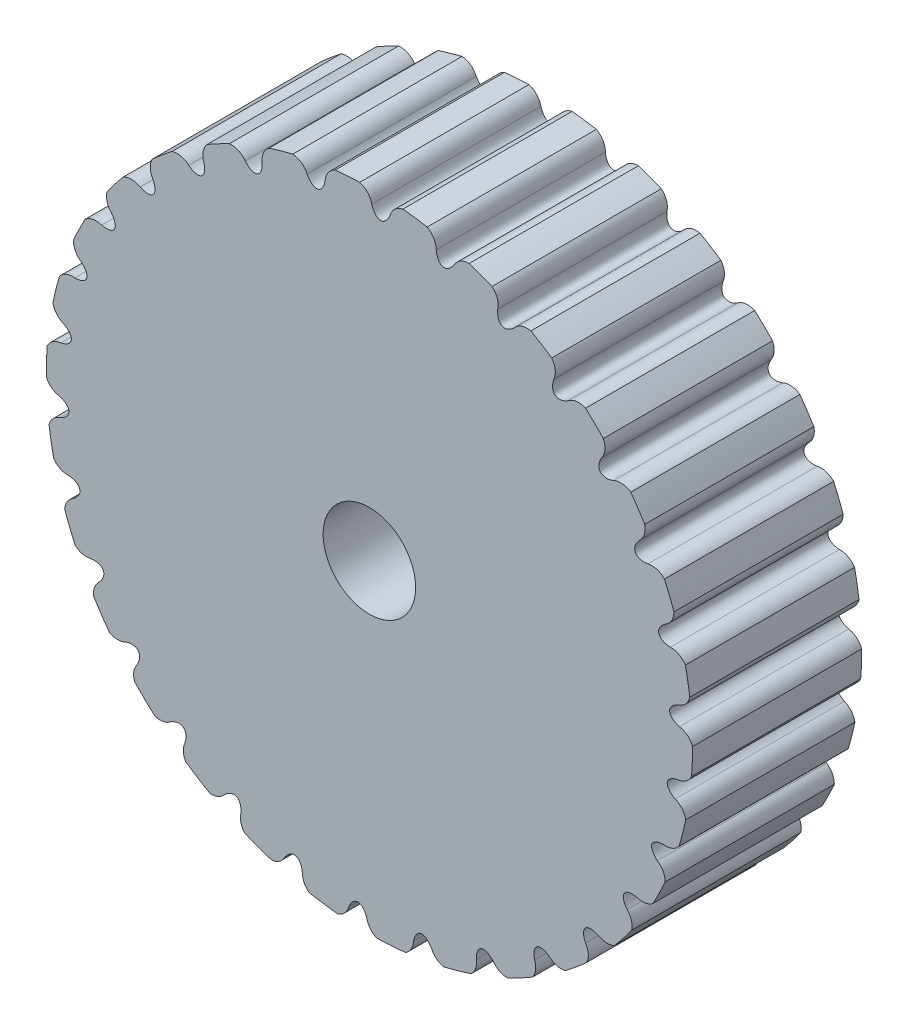
from build123d import *

# Parameters (mm, degrees)
SKETCH_1_R               = 28.647889755
EXTRUDE_1_DEPTH          = 15
CUT_EXTRUDE_3_DEPTH      = 15
PATTERN_CIRCULAR_1_DEPTH = 15
SKETCH_3_R               = 4.1
CUT_EXTRUDE_4_DEPTH      = 15


# Read off the part's stored shape, not the designer's step: Круговой массив1
with BuildPart() as part:
    # Эскиз1 → Бобышка-Вытянуть1 (new body)
    with BuildSketch(Plane.XY):
        Circle(SKETCH_1_R)
    extrude(amount=EXTRUDE_1_DEPTH)

    # Эскиз2 → Вырез-Вытянуть3 (cut)
    with BuildSketch(Plane.XY.offset(15)):
        with BuildLine():
            Line((4.783265488, 28.313897399), (4.555060767, 28.370295608))
            Line((4.555060767, 28.370295608), (7.420191225, 29.5242539))
            Line((7.420191225, 29.5242539), (9.194548177, 27.20324794))
            ThreePointArc((9.194548177, 27.20324794), (8.209649641, 27.119585332), (7.490641127, 26.441314505))
            add(Edge.make_bspline(
                [(5.923227103, 26.83594973), (6.165415766, 24.487827022), (7.490641127, 26.441314505)],
                knots=[5.342155302, 5.342155302, 5.342155302, 7.224215313, 7.224215313, 7.224215313], degree=2, weights=[1, 0.588955923, 1]))
            ThreePointArc((5.923227103, 26.83594973), (5.611124163, 27.773828354), (4.783265488, 28.313897399))
        make_face()
    extrude(amount=-CUT_EXTRUDE_3_DEPTH, mode=Mode.SUBTRACT)

    # Круговой массив1 outline → Круговой массив1 (cut)
    with BuildSketch(Plane.XY):
        with BuildLine():
            ThreePointArc((-0.857374536, 28.635057121), (-0.162957427, 28.208698815), (0.206087934, 27.482198954))
            add(Edge.make_bspline(
                [(0.206087934, 27.482198954), (0.931186357, 25.235742215), (1.821299478, 27.422071155)],
                knots=[5.342155302, 5.342155302, 5.342155302, 7.224215313, 7.224215313, 7.224215313], degree=2, weights=[1, 0.588955923, 1]))
            ThreePointArc((1.821299478, 27.422071155), (2.244682428, 28.120376446), (2.971136581, 28.493401602))
            ThreePointArc((2.971136581, 28.493401602), (1.059251654, 28.628300218), (-0.857374536, 28.635057121))
        make_face()
        with BuildLine():
            ThreePointArc((12.832183285, 24.303267333), (13.501250761, 24.768396637), (14.314771432, 24.815094323))
            ThreePointArc((14.314771432, 24.815094323), (12.623452266, 25.716726859), (10.875629889, 26.503250026))
            ThreePointArc((10.875629889, 26.503250026), (11.338834392, 25.830698896), (11.381070295, 25.015162532))
            add(Edge.make_bspline(
                [(11.381070295, 25.015162532), (11.129764393, 22.667998084), (12.832183285, 24.303267333)],
                knots=[5.342155302, 5.342155302, 5.342155302, 7.224215313, 7.224215313, 7.224215313], degree=2, weights=[1, 0.588955923, 1]))
        make_face()
        with BuildLine():
            ThreePointArc((17.612474929, 21.10137256), (18.358599847, 21.416600687), (19.159842369, 21.297934825))
            ThreePointArc((19.159842369, 21.297934825), (17.699326857, 22.526327181), (16.160266483, 23.654753743))
            ThreePointArc((16.160266483, 23.654753743), (16.469724734, 22.902549902), (16.341083574, 22.099414496))
            add(Edge.make_bspline(
                [(16.341083574, 22.099414496), (15.60726638, 19.855790658), (17.612474929, 21.10137256)],
                knots=[5.342155302, 5.342155302, 5.342155302, 7.224215313, 7.224215313, 7.224215313], degree=2, weights=[1, 0.588955923, 1]))
        make_face()
        with BuildLine():
            ThreePointArc((21.622594375, 16.975568352), (22.410584503, 17.129375348), (23.165022955, 16.854770805))
            ThreePointArc((23.165022955, 16.854770805), (21.999775921, 18.349698823), (20.738225155, 19.764301275))
            ThreePointArc((20.738225155, 19.764301275), (20.878729366, 18.969013093), (20.586490558, 18.216137803))
            add(Edge.make_bspline(
                [(20.586490558, 18.216137803), (19.402233404, 16.174111702), (21.622594375, 16.975568352)],
                knots=[5.342155302, 5.342155302, 5.342155302, 7.224215313, 7.224215313, 7.224215313], degree=2, weights=[1, 0.588955923, 1]))
        make_face()
        with BuildLine():
            ThreePointArc((24.687280161, 12.10617215), (25.481178928, 12.09537403), (26.158350936, 11.680850301))
            ThreePointArc((26.158350936, 11.680850301), (25.336556291, 13.370134734), (24.405814099, 15.001927399))
            ThreePointArc((24.405814099, 15.001927399), (24.37163839, 14.202928876), (23.931746591, 13.535050278))
            add(Edge.make_bspline(
                [(23.931746591, 13.535050278), (22.348807198, 11.783868255), (24.687280161, 12.10617215)],
                knots=[5.342155302, 5.342155302, 5.342155302, 7.224215313, 7.224215313, 7.224215313], degree=2, weights=[1, 0.588955923, 1]))
        make_face()
        with BuildLine():
            ThreePointArc((26.672590812, 6.705999934), (27.437627943, 6.535289378), (28.012098975, 6.001991207))
            ThreePointArc((28.012098975, 6.001991207), (27.563858837, 7.80610489), (26.999554978, 9.577349243))
            ThreePointArc((26.999554978, 9.577349243), (26.794860301, 8.814063586), (26.230647931, 8.260737909))
            add(Edge.make_bspline(
                [(26.230647931, 8.260737909), (24.318208346, 6.87693502), (26.672590812, 6.705999934)],
                knots=[5.342155302, 5.342155302, 5.342155302, 7.224215313, 7.224215313, 7.224215313], degree=2, weights=[1, 0.588955923, 1]))
        make_face()
        with BuildLine():
            ThreePointArc((27.491758726, 1.011065144), (28.195948874, 0.692147013), (28.647816187, 0.06492419))
            ThreePointArc((28.647816187, 0.06492419), (28.584709819, 1.901565692), (28.403975718, 3.730382142))
            ThreePointArc((28.403975718, 3.730382142), (28.042285924, 3.039605739), (27.382721558, 2.623713456))
            add(Edge.make_bspline(
                [(27.382721558, 2.623713456), (25.224364568, 1.667768528), (27.491758726, 1.011065144)],
                knots=[5.342155302, 5.342155302, 5.342155302, 7.224215313, 7.224215313, 7.224215313], degree=2, weights=[1, 0.588955923, 1]))
        make_face()
        with BuildLine():
            ThreePointArc((27.108982334, -4.729736244), (27.724336798, -5.179251287), (28.039400855, -5.873124137))
            ThreePointArc((28.039400855, -5.873124137), (28.355168104, -4.084853649), (28.557002858, -2.280170013))
            ThreePointArc((28.557002858, -2.280170013), (28.059905537, -2.866538418), (27.337616327, -3.129658065))
            add(Edge.make_bspline(
                [(27.337616327, -3.129658065), (25.02767249, -3.615965652), (27.108982334, -4.729736244)],
                knots=[5.342155302, 5.342155302, 5.342155302, 7.224215313, 7.224215313, 7.224215313], degree=2, weights=[1, 0.588955923, 1]))
        make_face()
        with BuildLine():
            ThreePointArc((25.540990802, -10.265503661), (26.044359734, -10.823314562), (26.21407603, -11.55525012))
            ThreePointArc((26.21407603, -11.55525012), (26.886134897, -9.891275845), (27.452691243, -8.188487715))
            ThreePointArc((27.452691243, -8.188487715), (26.848014351, -8.645109932), (26.097303553, -8.747926709))
            add(Edge.make_bspline(
                [(26.097303553, -8.747926709), (23.736728498, -8.743342979), (25.540990802, -10.265503661)],
                knots=[5.342155302, 5.342155302, 5.342155302, 7.224215313, 7.224215313, 7.224215313], degree=2, weights=[1, 0.588955923, 1]))
        make_face()
        with BuildLine():
            ThreePointArc((22.856312883, -15.354297507), (23.229903283, -15.994639434), (23.251200211, -16.735688697))
            ThreePointArc((23.251200211, -16.735688697), (24.242719206, -15.264080485), (25.141227491, -13.733909413))
            ThreePointArc((25.141227491, -13.733909413), (24.4609655, -14.042989432), (23.715990856, -13.985547177))
            add(Edge.make_bspline(
                [(23.715990856, -13.985547177), (21.40795304, -13.490272462), (22.856312883, -15.354297507)],
                knots=[5.342155302, 5.342155302, 5.342155302, 7.224215313, 7.224215313, 7.224215313], degree=2, weights=[1, 0.588955923, 1]))
        make_face()
        with BuildLine():
            ThreePointArc((19.172281885, -19.773713073), (19.403909174, -20.468529373), (19.278931886, -21.190195203))
            ThreePointArc((19.278931886, -21.190195203), (20.541221205, -19.968971404), (21.726302463, -18.672690454))
            ThreePointArc((21.726302463, -18.672690454), (21.004535693, -18.824307162), (20.297753027, -18.613610323))
            add(Edge.make_bspline(
                [(20.297753027, -18.613610323), (18.143124779, -17.649290504), (19.172281885, -19.773713073)],
                knots=[5.342155302, 5.342155302, 5.342155302, 7.224215313, 7.224215313, 7.224215313], degree=2, weights=[1, 0.588955923, 1]))
        make_face()
        with BuildLine():
            ThreePointArc((14.64990764, -23.330600692), (14.733041941, -24.050621812), (14.468861342, -24.725566503))
            ThreePointArc((14.468861342, -24.725566503), (15.943901436, -23.801125908), (17.360070751, -22.788802755))
            ThreePointArc((17.360070751, -22.788802755), (16.631062948, -22.780697238), (15.991983462, -22.429847578))
            add(Edge.make_bspline(
                [(15.991983462, -22.429847578), (14.084932375, -21.038628059), (14.64990764, -23.330600692)],
                knots=[5.342155302, 5.342155302, 5.342155302, 7.224215313, 7.224215313, 7.224215313], degree=2, weights=[1, 0.588955923, 1]))
        make_face()
        with BuildLine():
            ThreePointArc((9.486839604, -25.869507306), (9.420504762, -26.585221903), (9.028813367, -27.187903865))
            ThreePointArc((9.028813367, -27.187903865), (10.651794196, -26.5940006), (12.236009839, -25.903313509))
            ThreePointArc((12.236009839, -25.903313509), (11.532600684, -25.740271022), (10.986864952, -25.267471063))
            add(Edge.make_bspline(
                [(10.986864952, -25.267471063), (9.410738309, -23.510154811), (9.486839604, -25.869507306)],
                knots=[5.342155302, 5.342155302, 5.342155302, 7.224215313, 7.224215313, 7.224215313], degree=2, weights=[1, 0.588955923, 1]))
        make_face()
        with BuildLine():
            ThreePointArc((3.908728626, -27.279470515), (3.697303481, -27.961993732), (3.194103602, -28.469269214))
            ThreePointArc((3.194103602, -28.469269214), (4.895897395, -28.22643754), (6.580062715, -27.881971992))
            ThreePointArc((6.580062715, -27.881971992), (5.932406683, -27.57494603), (5.501145194, -27.002463014))
            add(Edge.make_bspline(
                [(5.501145194, -27.002463014), (4.324827293, -24.955853184), (3.908728626, -27.279470515)],
                knots=[5.342155302, 5.342155302, 5.342155302, 7.224215313, 7.224215313, 7.224215313], degree=2, weights=[1, 0.588955923, 1]))
        make_face()
        with BuildLine():
            ThreePointArc((-1.840635079, -27.498868159), (-2.187677095, -28.120727086), (-2.78240365, -28.512450216))
            ThreePointArc((-2.78240365, -28.512450216), (-1.072871909, -28.627793022), (0.640497695, -28.640728869))
            ThreePointArc((0.640497695, -28.640728869), (0.075146707, -28.205840177), (-0.225423536, -27.558995958))
            add(Edge.make_bspline(
                [(-0.225423536, -27.558995958), (-0.950521958, -25.312539219), (-1.840635079, -27.498868159)],
                knots=[5.342155302, 5.342155302, 5.342155302, 7.224215313, 7.224215313, 7.224215313], degree=2, weights=[1, 0.588955923, 1]))
        make_face()
        with BuildLine():
            ThreePointArc((-7.509976728, -26.518111509), (-7.978370842, -27.053976967), (-8.641038475, -27.313623734))
            ThreePointArc((-8.641038475, -27.313623734), (-6.9945273, -27.780895869), (-5.323050455, -28.149009242))
            ThreePointArc((-5.323050455, -28.149009242), (-5.783761563, -27.606524107), (-5.942562704, -26.912746734))
            add(Edge.make_bspline(
                [(-5.942562704, -26.912746734), (-6.184751368, -24.564624026), (-7.509976728, -26.518111509)],
                knots=[5.342155302, 5.342155302, 5.342155302, 7.224215313, 7.224215313, 7.224215313], degree=2, weights=[1, 0.588955923, 1]))
        make_face()
        with BuildLine():
            ThreePointArc((-12.851518886, -24.380064337), (-13.422555546, -24.80745996), (-14.126437165, -24.922787975))
            ThreePointArc((-14.126437165, -24.922787975), (-12.611215775, -25.722729717), (-11.050881714, -26.430656457))
            ThreePointArc((-11.050881714, -26.430656457), (-11.38920951, -25.804013831), (-11.400405897, -25.091959536))
            add(Edge.make_bspline(
                [(-11.400405897, -25.091959536), (-11.149099994, -22.744795088), (-12.851518886, -24.380064337)],
                knots=[5.342155302, 5.342155302, 5.342155302, 7.224215313, 7.224215313, 7.224215313], degree=2, weights=[1, 0.588955923, 1]))
        make_face()
        with BuildLine():
            ThreePointArc((-17.63181053, -21.178169564), (-18.28274456, -21.478183093), (-18.998571432, -21.441918547))
            ThreePointArc((-18.998571432, -21.441918547), (-17.678313507, -22.542821894), (-16.294401948, -23.562556155))
            ThreePointArc((-16.294401948, -23.562556155), (-16.49739744, -22.877478541), (-16.360419175, -22.1762115))
            add(Edge.make_bspline(
                [(-16.360419175, -22.1762115), (-15.626601981, -19.932587662), (-17.63181053, -21.178169564)],
                knots=[5.342155302, 5.342155302, 5.342155302, 7.224215313, 7.224215313, 7.224215313], degree=2, weights=[1, 0.588955923, 1]))
        make_face()
        with BuildLine():
            ThreePointArc((-21.641929976, -17.052365356), (-22.346487111, -17.210373169), (-23.043239243, -17.020890476))
            ThreePointArc((-23.043239243, -17.020890476), (-21.974961644, -18.379408264), (-20.826710345, -19.671037684))
            ThreePointArc((-20.826710345, -19.671037684), (-20.886313744, -18.954731126), (-20.60582616, -18.292934807))
            add(Edge.make_bspline(
                [(-20.60582616, -18.292934807), (-19.421569006, -16.250908707), (-21.641929976, -17.052365356)],
                knots=[5.342155302, 5.342155302, 5.342155302, 7.224215313, 7.224215313, 7.224215313], degree=2, weights=[1, 0.588955923, 1]))
        make_face()
        with BuildLine():
            ThreePointArc((-24.706615762, -12.182969154), (-25.435640514, -12.189364753), (-26.081571728, -11.851295441))
            ThreePointArc((-26.081571728, -11.851295441), (-25.313610369, -13.413527406), (-24.452181812, -14.926231675))
            ThreePointArc((-24.452181812, -14.926231675), (-24.365257967, -14.206658253), (-23.951082192, -13.611847282))
            add(Edge.make_bspline(
                [(-23.951082192, -13.611847282), (-22.368142799, -11.860665259), (-24.706615762, -12.182969154)],
                knots=[5.342155302, 5.342155302, 5.342155302, 7.224215313, 7.224215313, 7.224215313], degree=2, weights=[1, 0.588955923, 1]))
        make_face()
        with BuildLine():
            ThreePointArc((-26.691926413, -6.782796938), (-27.414215692, -6.633689604), (-27.9781356, -6.158369568))
            ThreePointArc((-27.9781356, -6.158369568), (-27.548174286, -7.861277305), (-27.014667971, -9.534636951))
            ThreePointArc((-27.014667971, -9.534636951), (-26.783013157, -8.839829882), (-26.249983532, -8.337534914))
            add(Edge.make_bspline(
                [(-26.249983532, -8.337534914), (-24.337543947, -6.953732025), (-26.691926413, -6.782796938)],
                knots=[5.342155302, 5.342155302, 5.342155302, 7.224215313, 7.224215313, 7.224215313], degree=2, weights=[1, 0.588955923, 1]))
        make_face()
        with BuildLine():
            ThreePointArc((-27.511094327, -1.087862148), (-28.194451259, -0.785686653), (-28.647250829, -0.191330468))
            ThreePointArc((-28.647250829, -0.191330468), (-28.580450721, -1.964541662), (-28.403997586, -3.730215608))
            ThreePointArc((-28.403997586, -3.730215608), (-28.034329199, -3.087601599), (-27.402057159, -2.70051046))
            add(Edge.make_bspline(
                [(-27.402057159, -2.70051046), (-25.243700169, -1.744565532), (-27.511094327, -1.087862148)],
                knots=[5.342155302, 5.342155302, 5.342155302, 7.224215313, 7.224215313, 7.224215313], degree=2, weights=[1, 0.588955923, 1]))
        make_face()
        with BuildLine():
            ThreePointArc((-27.128317935, 4.65293924), (-27.740839365, 5.098983378), (-28.057199417, 5.787499312))
            ThreePointArc((-28.057199417, 5.787499312), (-28.364514485, 4.019440926), (-28.560525818, 2.235610059))
            ThreePointArc((-28.560525818, 2.235610059), (-28.064448769, 2.799915602), (-27.356951928, 3.052861061))
            add(Edge.make_bspline(
                [(-27.356951928, 3.052861061), (-25.047008091, 3.539168647), (-27.128317935, 4.65293924)],
                knots=[5.342155302, 5.342155302, 5.342155302, 7.224215313, 7.224215313, 7.224215313], degree=2, weights=[1, 0.588955923, 1]))
        make_face()
        with BuildLine():
            ThreePointArc((-25.560326403, 10.188706657), (-26.071906236, 10.762483272), (-26.232073769, 11.514334249))
            ThreePointArc((-26.232073769, 11.514334249), (-26.908877838, 9.829236027), (-27.477560699, 8.104643446))
            ThreePointArc((-27.477560699, 8.104643446), (-26.871488669, 8.566597426), (-26.116639154, 8.671129705))
            add(Edge.make_bspline(
                [(-26.116639154, 8.671129705), (-23.756064099, 8.666545975), (-25.560326403, 10.188706657)],
                knots=[5.342155302, 5.342155302, 5.342155302, 7.224215313, 7.224215313, 7.224215313], degree=2, weights=[1, 0.588955923, 1]))
        make_face()
        with BuildLine():
            ThreePointArc((-22.875648484, 15.277500503), (-23.259639027, 15.956133457), (-23.251102266, 16.735824773))
            ThreePointArc((-23.251102266, 16.735824773), (-24.276291668, 15.210629513), (-25.201582745, 13.622841645))
            ThreePointArc((-25.201582745, 13.622841645), (-24.506578542, 13.961311127), (-23.735326457, 13.908750173))
            add(Edge.make_bspline(
                [(-23.735326457, 13.908750173), (-21.427288642, 13.413475458), (-22.875648484, 15.277500503)],
                knots=[5.342155302, 5.342155302, 5.342155302, 7.224215313, 7.224215313, 7.224215313], degree=2, weights=[1, 0.588955923, 1]))
        make_face()
        with BuildLine():
            ThreePointArc((-19.191617486, 19.696916069), (-19.426545128, 20.451444923), (-19.245395299, 21.220658501))
            ThreePointArc((-19.245395299, 21.220658501), (-20.581161725, 19.927803928), (-21.830266635, 18.551038947))
            ThreePointArc((-21.830266635, 18.551038947), (-21.071752285, 18.748725017), (-20.317088628, 18.536813319))
            add(Edge.make_bspline(
                [(-20.317088628, 18.536813319), (-18.16246038, 17.5724935), (-19.191617486, 19.696916069)],
                knots=[5.342155302, 5.342155302, 5.342155302, 7.224215313, 7.224215313, 7.224215313], degree=2, weights=[1, 0.588955923, 1]))
        make_face()
        with BuildLine():
            ThreePointArc((-14.669243241, 23.253803687), (-14.740427771, 24.050358316), (-14.392177641, 24.770280785))
            ThreePointArc((-14.392177641, 24.770280785), (-15.98465954, 23.773772245), (-17.508407188, 22.675036165))
            ThreePointArc((-17.508407188, 22.675036165), (-16.715679725, 22.719476303), (-16.011319063, 22.353050574))
            add(Edge.make_bspline(
                [(-16.011319063, 22.353050574), (-14.104267976, 20.961831054), (-14.669243241, 23.253803687)],
                knots=[5.342155302, 5.342155302, 5.342155302, 7.224215313, 7.224215313, 7.224215313], degree=2, weights=[1, 0.588955923, 1]))
        make_face()
        with BuildLine():
            ThreePointArc((-9.506175206, 25.792710302), (-9.407061789, 26.594209629), (-8.906714626, 27.228147605))
            ThreePointArc((-8.906714626, 27.228147605), (-10.687718473, 26.579583541), (-12.421936978, 25.814667712))
            ThreePointArc((-12.421936978, 25.814667712), (-11.627411248, 25.699282187), (-11.006200554, 25.190674058))
            add(Edge.make_bspline(
                [(-11.006200554, 25.190674058), (-9.430073911, 23.433357807), (-9.506175206, 25.792710302)],
                knots=[5.342155302, 5.342155302, 5.342155302, 7.224215313, 7.224215313, 7.224215313], degree=2, weights=[1, 0.588955923, 1]))
        make_face()
        with BuildLine():
            ThreePointArc((-3.928064227, 27.20267351), (-3.661058057, 27.970972068), (-3.032301922, 28.486957234))
            ThreePointArc((-3.032301922, 28.486957234), (-4.922216324, 28.221859858), (-6.790287254, 27.831521453))
            ThreePointArc((-6.790287254, 27.831521453), (-6.028379538, 27.556625578), (-5.520480796, 26.92566601))
            add(Edge.make_bspline(
                [(-5.520480796, 26.92566601), (-4.344162894, 24.879056179), (-3.928064227, 27.20267351)],
                knots=[5.342155302, 5.342155302, 5.342155302, 7.224215313, 7.224215313, 7.224215313], degree=2, weights=[1, 0.588955923, 1]))
        make_face()
    extrude(amount=PATTERN_CIRCULAR_1_DEPTH, mode=Mode.SUBTRACT)

    # Эскиз3 → Вырез-Вытянуть4 (cut)
    with BuildSketch(Plane.XY.offset(15)):
        Circle(SKETCH_3_R)
    extrude(amount=-CUT_EXTRUDE_4_DEPTH, mode=Mode.SUBTRACT)


solid = part.part
